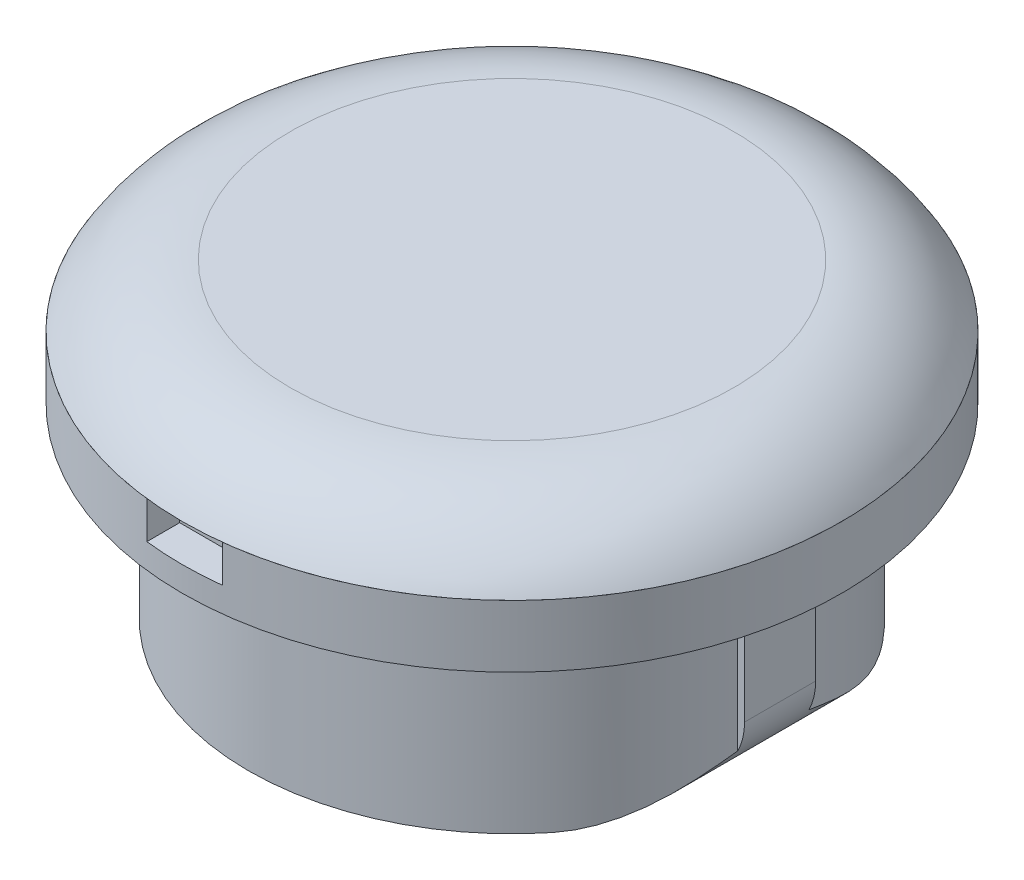
from build123d import *

# Parameters (mm, degrees)
SKETCH1_R           = 21.5
SKETCH1_R_2         = 16.5
BOSS_EXTRUDE2_DEPTH = 15
BOSS_EXTRUDE3_START = 5
SKETCH3_R           = 26.5
SKETCH3_R_2         = 16.5
BOSS_EXTRUDE3_DEPTH = 5
BOSS_EXTRUDE4_START = -13
BOSS_EXTRUDE4_DEPTH = 13
FILLET1_R           = 5
SKETCH7_R           = 16.5
SKETCH7_R_2         = 11.5
BOSS_EXTRUDE5_DEPTH = 5
SKETCH8_R           = 26.5
BOSS_EXTRUDE6_DEPTH = 5
FILLET2_R           = 10
CUT_EXTRUDE2_DEPTH  = 5
BOSS_EXTRUDE8_DEPTH = 5
CUT_EXTRUDE3_DEPTH  = 3
MOVE_START          = 4
MOVE_FACE1_DEPTH    = 6
MOVE_START_2        = -15
MOVE_FACE1_2_DEPTH  = 15
MOVE_START_3        = -2
MOVE_FACE1_3_DEPTH  = 2


with BuildPart() as part:
    # Sketch1 → Boss-Extrude2 (new body)
    with BuildSketch(Plane(origin=(0, 0, 0), x_dir=(1, 0, 0), z_dir=(0, 1, 0))):
        with Locations(Location((0, 0, 0), (0, 0, 270))):
            Circle(SKETCH1_R)
        with Locations(Location((0, 0, 0), (0, 0, 270))):
            Circle(SKETCH1_R_2, mode=Mode.SUBTRACT)
    extrude(amount=-BOSS_EXTRUDE2_DEPTH)

    # Sketch3 → Boss-Extrude3 (add)
    with BuildSketch(Plane(origin=(0, 0, 0), x_dir=(1, 0, 0), z_dir=(0, 1, 0)).offset(BOSS_EXTRUDE3_START)):
        with Locations(Location((0, 0, 0), (0, 0, 270))):
            Circle(SKETCH3_R)
        with Locations(Location((0, 0, 0), (0, 0, 270))):
            Circle(SKETCH3_R_2, mode=Mode.SUBTRACT)
    extrude(amount=-BOSS_EXTRUDE3_DEPTH)

    # Sketch5 → Boss-Extrude4 (add)
    with BuildSketch(Plane.XZ.offset(15).offset(BOSS_EXTRUDE4_START)):
        with BuildLine():
            Line((21.559218876, 2.857829749), (21.309218876, 2.857829749))
            ThreePointArc((21.309218876, 2.857829749), (21.452251698, 1.432095345), (21.5, 0))
            ThreePointArc((21.5, 0), (21.452251698, -1.432095345), (21.309218876, -2.857829749))
            Line((21.309218876, -2.857829749), (21.559218876, -2.857829749))
            Line((21.559218876, -2.857829749), (21.559218876, 2.857829749))
        make_face()
        with BuildLine():
            ThreePointArc((-21.309218876, -2.857829749), (-21.5, 0), (-21.309218876, 2.857829749))
            Line((-21.309218876, 2.857829749), (-21.559218876, 2.857829749))
            Line((-21.559218876, 2.857829749), (-21.559218876, -2.857829749))
            Line((-21.559218876, -2.857829749), (-21.309218876, -2.857829749))
        make_face()
    extrude(amount=BOSS_EXTRUDE4_DEPTH)

    # Fillet1
    fillet1_edges = [part.edges().sort_by_distance(p)[0] for p in [
        (-21.559218876, -15, 0),
        (21.559218876, -15, 0),
    ]]
    fillet(fillet1_edges, radius=FILLET1_R)

    # Sketch9 → Cut-Extrude2 (cut)
    with BuildSketch(Plane(origin=(0, 5, 0), x_dir=(1, 0, 0), z_dir=(0, 1, 0))):
        with BuildLine():
            Line((16.30950643, 2.5), (17.30950643, 2.5))
            Line((17.30950643, 2.5), (17.30950643, -2.5))
            Line((17.30950643, -2.5), (16.30950643, -2.5))
            ThreePointArc((16.30950643, -2.5), (16.5, 0), (16.30950643, 2.5))
        make_face()
        with BuildLine():
            Line((-17.30950643, -2.5), (-16.30950643, -2.5))
            ThreePointArc((-16.30950643, -2.5), (-16.5, 0), (-16.30950643, 2.5))
            Line((-16.30950643, 2.5), (-17.30950643, 2.5))
            Line((-17.30950643, 2.5), (-17.30950643, -2.5))
        make_face()
    extrude(amount=-CUT_EXTRUDE2_DEPTH, mode=Mode.SUBTRACT)

    # Sketch15 → Cut-Extrude3 (cut)
    with BuildSketch(Plane(origin=(0, 5, 0), x_dir=(1, 0, 0), z_dir=(0, 1, 0))):
        with BuildLine():
            Line((3.039184032, 23.685543065), (3.039184032, 26.325146921))
            ThreePointArc((3.039184032, 26.325146921), (0, 26.5), (-3.039184032, 26.325146921))
            Line((-3.039184032, 26.325146921), (-3.039184032, 23.685543065))
            Line((-3.039184032, 23.685543065), (3.039184032, 23.685543065))
        make_face()
        with BuildLine():
            Line((-3.039184032, -26.325146921), (-3.039184032, -23.685543065))
            Line((-3.039184032, -23.685543065), (3.039184032, -23.685543065))
            Line((3.039184032, -23.685543065), (3.039184032, -26.325146921))
            ThreePointArc((3.039184032, -26.325146921), (0, -26.5), (-3.039184032, -26.325146921))
        make_face()
    extrude(amount=-CUT_EXTRUDE3_DEPTH, mode=Mode.SUBTRACT)

    # Move Face1 2 outline → Move Face1 2 (cut)
    with BuildSketch(Plane(origin=(0, 0, 0), x_dir=(1, 0, 0), z_dir=(0, 1, 0)).offset(MOVE_START_2)):
        with BuildLine():
            ThreePointArc((-21.006494451, 2.857829749), (0, 21.2), (21.006494451, 2.857829749))
            Line((21.006494451, 2.857829749), (21.309218876, 2.857829749))
            ThreePointArc((21.309218876, 2.857829749), (0, 21.5), (-21.309218876, 2.857829749))
            Line((-21.309218876, 2.857829749), (-21.006494451, 2.857829749))
        make_face()
        with BuildLine():
            Line((21.309218876, -2.857829749), (21.006494451, -2.857829749))
            ThreePointArc((21.006494451, -2.857829749), (0, -21.2), (-21.006494451, -2.857829749))
            Line((-21.006494451, -2.857829749), (-21.309218876, -2.857829749))
            ThreePointArc((-21.309218876, -2.857829749), (0, -21.5), (21.309218876, -2.857829749))
        make_face()
    extrude(amount=MOVE_FACE1_2_DEPTH, mode=Mode.SUBTRACT)

    # Move Face1 3 outline → Move Face1 3 (cut)
    with BuildSketch(Plane(origin=(0, 0, 0), x_dir=(1, 0, 0), z_dir=(0, 1, 0)).offset(MOVE_START_3)):
        with BuildLine():
            ThreePointArc((21.006494451, 2.857829749), (21.2, 0), (21.006494451, -2.857829749))
            Line((21.006494451, -2.857829749), (21.309218876, -2.857829749))
            ThreePointArc((21.309218876, -2.857829749), (21.5, 0), (21.309218876, 2.857829749))
            Line((21.309218876, 2.857829749), (21.006494451, 2.857829749))
        make_face()
        with BuildLine():
            ThreePointArc((-21.006494451, -2.857829749), (-21.2, 0), (-21.006494451, 2.857829749))
            Line((-21.006494451, 2.857829749), (-21.309218876, 2.857829749))
            ThreePointArc((-21.309218876, 2.857829749), (-21.5, 0), (-21.309218876, -2.857829749))
            Line((-21.309218876, -2.857829749), (-21.006494451, -2.857829749))
        make_face()
    extrude(amount=MOVE_FACE1_3_DEPTH, mode=Mode.SUBTRACT)


with BuildPart() as body_2:
    # Sketch7 → Boss-Extrude5 (new body)
    with BuildSketch(Plane(origin=(0, 5, 0), x_dir=(1, 0, 0), z_dir=(0, 1, 0))):
        with Locations(Location((39.28088424, 30.935612703, 0), (0, 0, 270))):
            Circle(SKETCH7_R)
        with Locations(Location((39.28088424, 30.935612703, 0), (0, 0, 270))):
            Circle(SKETCH7_R_2, mode=Mode.SUBTRACT)
    extrude(amount=BOSS_EXTRUDE5_DEPTH)

    # Sketch8 → Boss-Extrude6 (add)
    with BuildSketch(Plane(origin=(0, 10, 0), x_dir=(1, 0, 0), z_dir=(0, 1, 0))):
        with Locations(Location((39.28088424, 30.935612703, 0), (0, 0, 270))):
            Circle(SKETCH8_R)
    extrude(amount=BOSS_EXTRUDE6_DEPTH)


with BuildPart() as body_2_1:
    # Body-Move/Copy1: moved
    add(body_2.part.moved(Location((-39.167227513, 0, 30.951860953))))


with BuildPart() as body_2_2:
    # Body-Move/Copy2: moved
    add(body_2_1.part.moved(Location((55, 0, 0))))

    # Fillet2
    # the kernel refuses this fillet: 10 mm, written as the material it takes off along each edge
    with BuildSketch(Plane(origin=(55.113656727, 15, 0.01624825), x_dir=(0, 0, 1), z_dir=(-1, 0, 0))) as fillet2_piece_1:
        with BuildLine():
            CenterArc((17.839745962, -10), FILLET2_R, 30, 60)
            Line((17.839745962, 0), (17.839745962, 0.2))
            Line((17.839745962, 0.2), (26.5, 0.2))
            Line((26.5, 0.2), (26.7, 0))
            ThreePointArc((26.7, 0), (26.7, -2.5), (26.673205081, -4.9))
            Line((26.673205081, -4.9), (26.5, -5))
        make_face()
    revolve(axis=Axis((55.113656727, 15, 0.01624825), (0, 1, 0)), mode=Mode.SUBTRACT)

    # Sketch10 → Boss-Extrude8 (add)
    with BuildSketch(Plane.XZ.offset(-5)):
        with BuildLine():
            Line((71.423163157, 2.51624825), (72.423163157, 2.51624825))
            Line((72.423163157, 2.51624825), (72.423163157, -2.48375175))
            Line((72.423163157, -2.48375175), (71.423163157, -2.48375175))
            ThreePointArc((71.423163157, -2.48375175), (71.613656727, 0.01624825), (71.423163157, 2.51624825))
        make_face()
        with BuildLine():
            Line((37.804150296, -2.48375175), (38.804150296, -2.48375175))
            ThreePointArc((38.804150296, -2.48375175), (38.613656727, 0.01624825), (38.804150296, 2.51624825))
            Line((38.804150296, 2.51624825), (37.804150296, 2.51624825))
            Line((37.804150296, 2.51624825), (37.804150296, -2.48375175))
        make_face()
    extrude(amount=-BOSS_EXTRUDE8_DEPTH)

    # Move Face1: read off the stored shape, not the designer's step
    # Move Face1 outline → Move Face1 (cut)
    with BuildSketch(Plane(origin=(0, 0, 0), x_dir=(1, 0, 0), z_dir=(0, 1, 0)).offset(MOVE_START)):
        with BuildLine():
            ThreePointArc((38.804150296, -2.51624825), (55.113656727, -16.51624825), (71.423163157, -2.51624825))
            Line((71.423163157, -2.51624825), (72.423163157, -2.51624825))
            Line((72.423163157, -2.51624825), (72.423163157, 2.48375175))
            Line((72.423163157, 2.48375175), (71.423163157, 2.48375175))
            ThreePointArc((71.423163157, 2.48375175), (55.113656727, 16.48375175), (38.804150296, 2.48375175))
            Line((38.804150296, 2.48375175), (37.804150296, 2.48375175))
            Line((37.804150296, 2.48375175), (37.804150296, -2.51624825))
            Line((37.804150296, -2.51624825), (38.804150296, -2.51624825))
        make_face()
        with BuildLine():
            Line((72.123163157, -2.21624825), (71.163578845, -2.21624825))
            ThreePointArc((71.163578845, -2.21624825), (55.113656726, -16.21624825), (39.063734608, -2.21624825))
            Line((39.063734608, -2.21624825), (38.104150296, -2.21624825))
            Line((38.104150296, -2.21624825), (38.104150296, 2.18375175))
            Line((38.104150296, 2.18375175), (39.063734608, 2.18375175))
            ThreePointArc((39.063734608, 2.18375175), (55.113656726, 16.18375175), (71.163578845, 2.18375175))
            Line((71.163578845, 2.18375175), (72.123163157, 2.18375175))
            Line((72.123163157, 2.18375175), (72.123163157, -2.21624825))
        make_face(mode=Mode.SUBTRACT)
    extrude(amount=MOVE_FACE1_DEPTH, mode=Mode.SUBTRACT)


with BuildPart() as body_2_3:
    # Body-Move/Copy3: read off the stored shape, not the designer's step
    # Body-Move/Copy3: moved
    add(body_2_2.part.moved(Location((-55.1136567, -5, -0.0162482))))


solid = Compound([part.part, body_2_3.part])
